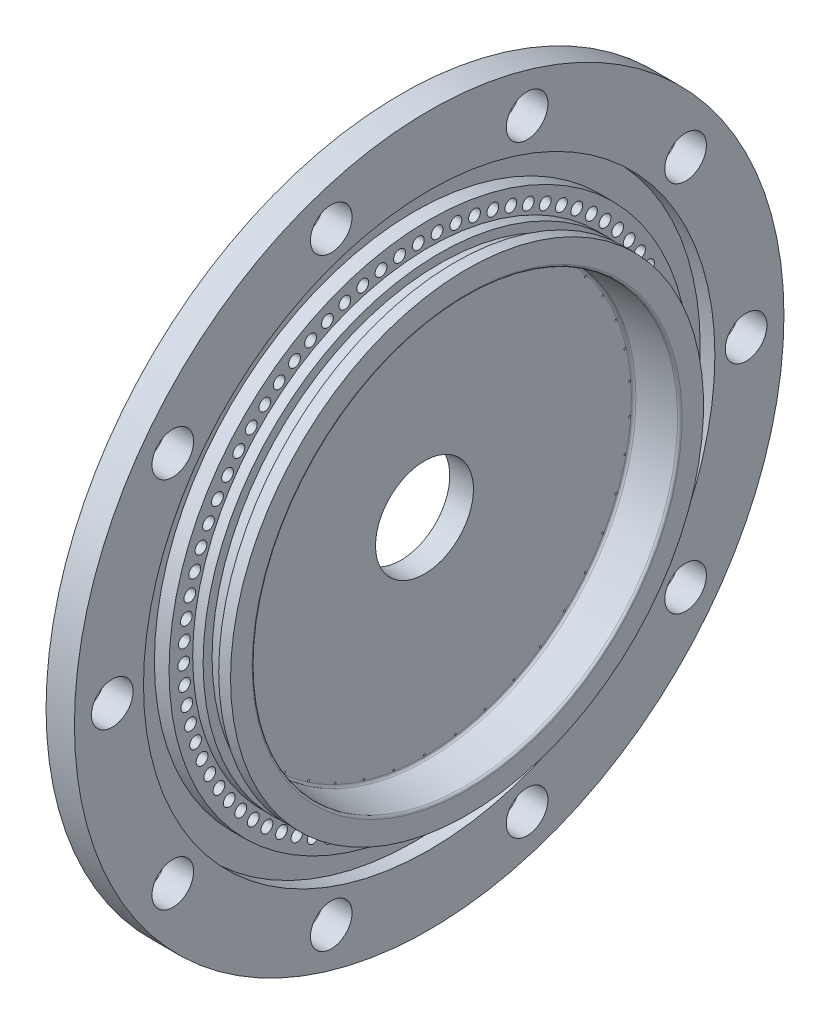
from build123d import *

# Parameters (mm, degrees)
SKETCH5_R          = 1.25
CUT_EXTRUDE1_DEPTH = 107.367288205
CIRPATTERN1_COUNT  = 82
SKETCH6_R          = 4.4
CUT_EXTRUDE2_DEPTH = 107.367288205
CIRPATTERN2_COUNT  = 10
CUT_EXTRUDE3_REACH = 108.447
SKETCH10_R         = 0.7
CUT_EXTRUDE4_DEPTH = 3.8
CIRPATTERN3_COUNT  = 42


with BuildPart() as part:
    # Sketch4 → Revolve2 (revolve)
    with BuildSketch(Plane.XY):
        with BuildLine():
            Line((0, 10.35), (0, 75))
            Line((0, 75), (6, 75))
            Line((6, 75), (6, 60.4))
            Line((6, 60.4), (2.9, 60.4))
            Line((2.9, 60.4), (2.9, 55))
            Line((2.9, 55), (6, 55))
            Line((6, 55), (6, 50))
            Line((6, 50), (8.2, 50))
            Line((8.2, 50), (8.2, 48.1))
            Line((8.2, 48.1), (11.5, 48.1))
            Line((11.5, 48.1), (11.5, 50))
            Line((11.5, 50), (14, 50))
            Line((14, 50), (14, 45.458165587))
            ThreePointArc((14, 45.458165587), (13.868638668, 45.120370483), (13.543577871, 44.960068238))
            Line((13.543577871, 44.960068238), (5.456422129, 44.25253379))
            ThreePointArc((5.456422129, 44.25253379), (5.131361332, 44.092231545), (5, 43.754436441))
            Line((5, 43.754436441), (5, 10.35))
            Line((5, 10.35), (0, 10.35))
        make_face()
    revolve(axis=Axis((0, 0, 0), (1, 0, 0)))

    # Sketch5 → Cut-Extrude1 (cut, symmetric)
    with BuildSketch(Plane(origin=(6, 0, 0), x_dir=(0, 0, -1), z_dir=(1, 0, 0))):
        with Locations((1.675486715, 51.872948097)):
            Circle(SKETCH5_R)
    cut_extrude1 = extrude(amount=CUT_EXTRUDE1_DEPTH, both=True, mode=Mode.SUBTRACT)

    # CirPattern1: Cut-Extrude1 ×82 about axis
    cirpattern1_axis = Axis((14, 0, 0), (-1, 0, 0))
    for i in range(1, CIRPATTERN1_COUNT):
        add(cut_extrude1.rotate(cirpattern1_axis, i * 360 / CIRPATTERN1_COUNT), mode=Mode.SUBTRACT)

    # Sketch6 → Cut-Extrude2 (cut, through all)
    with BuildSketch(Plane(origin=(6, 0, 0), x_dir=(0, 0, -1), z_dir=(1, 0, 0))):
        with Locations((67, 0)):
            Circle(SKETCH6_R)
    cut_extrude2 = extrude(amount=-CUT_EXTRUDE2_DEPTH, mode=Mode.SUBTRACT)

    # CirPattern2: Cut-Extrude2 ×10 about axis
    cirpattern2_axis = Axis((6, 0, 0), (-1, 0, 0))
    for i in range(1, CIRPATTERN2_COUNT):
        add(cut_extrude2.rotate(cirpattern2_axis, i * 360 / CIRPATTERN2_COUNT), mode=Mode.SUBTRACT)

    # Sketch9 → Cut-Extrude3 (cut, up to next)
    with BuildSketch(Plane(origin=(5, 0, 0), x_dir=(0, 0, -1), z_dir=(1, 0, 0)), mode=Mode.PRIVATE) as cut_extrude3_sk1:
        with BuildLine():
            ThreePointArc((0, 43.3), (0.141421356, 43.358578644), (0.2, 43.5))
            ThreePointArc((0.2, 43.5), (-0.141421356, 43.641421356), (0, 43.3))
        make_face()
    cut_extrude3_tool1 = extrude(cut_extrude3_sk1.sketch, amount=-CUT_EXTRUDE3_REACH, mode=Mode.PRIVATE) & part.part
    cut_extrude3 = cut_extrude3_tool1.solids().sort_by_distance((5, 43.5, 0))[0]
    add(cut_extrude3, mode=Mode.SUBTRACT)

    # Sketch10 → Cut-Extrude4 (cut)
    with BuildSketch(Plane.ZY):
        with Locations((0, 43.5)):
            Circle(SKETCH10_R)
    cut_extrude4 = extrude(amount=-CUT_EXTRUDE4_DEPTH, mode=Mode.SUBTRACT)

    # CirPattern3: Cut-Extrude3, Cut-Extrude4 ×42 about axis
    cirpattern3_axis = Axis((0, 0, 0), (-1, 0, 0))
    add([cut_extrude3.rotate(cirpattern3_axis, i * 360 / CIRPATTERN3_COUNT) for i in range(1, CIRPATTERN3_COUNT)], mode=Mode.SUBTRACT)
    add([cut_extrude4.rotate(cirpattern3_axis, i * 360 / CIRPATTERN3_COUNT) for i in range(1, CIRPATTERN3_COUNT)], mode=Mode.SUBTRACT)


solid = part.part
